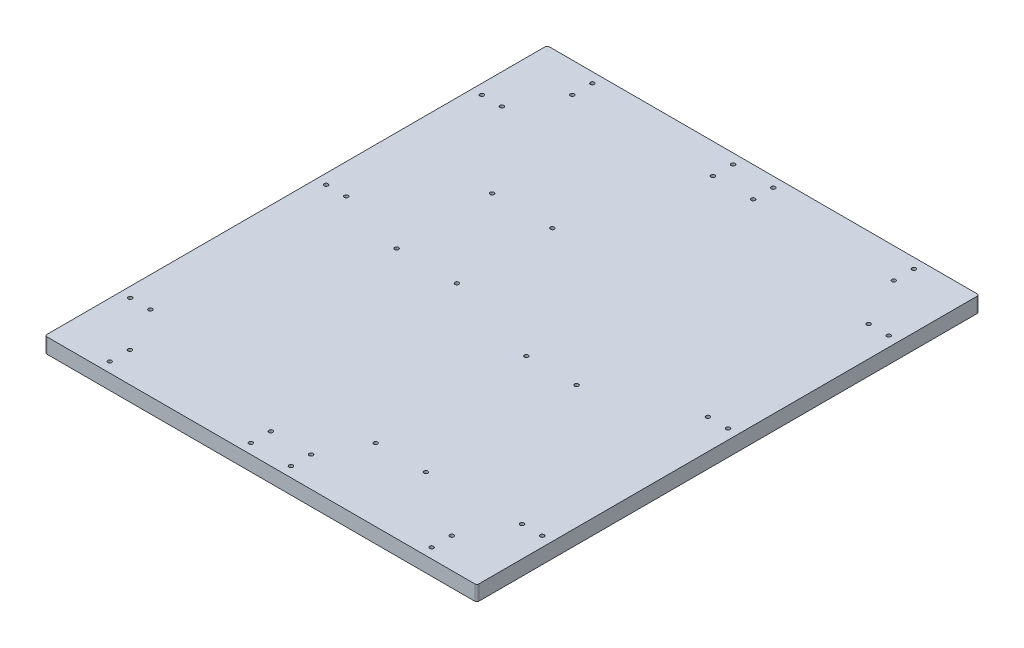
from build123d import *

# Parameters (mm, degrees)
SKETCH1_W           = 430
SKETCH1_H           = 500
BOSS_EXTRUDE1_DEPTH = 15
SKETCH12_R          = 1.95
CUT_EXTRUDE3_DEPTH  = 50.8
SKETCH6_R           = 1.95
CUT_EXTRUDE4_DEPTH  = 50.8
SKETCH7_R           = 1.95
CUT_EXTRUDE5_DEPTH  = 50.8
FILLET1_R           = 2


with BuildPart() as part:
    # Sketch1 → Boss-Extrude1 (new body)
    with BuildSketch(Plane(origin=(0, 0, 0), x_dir=(1, 0, 0), z_dir=(0, 1, 0))):
        Rectangle(SKETCH1_W, SKETCH1_H)
    extrude(amount=BOSS_EXTRUDE1_DEPTH)

    # Sketch12 → Cut-Extrude3 (cut)
    with BuildSketch(Plane(origin=(0, 0, 0), x_dir=(-1, 0, 0), z_dir=(0, -1, 0))):
        with Locations((-185, -175)):
            Circle(SKETCH12_R)
        with Locations((-205, 170)):
            Circle(SKETCH12_R)
        with Locations((-185, 10)):
            Circle(SKETCH12_R)
        with Locations((-205, 10)):
            Circle(SKETCH12_R)
        with Locations((-205, -175)):
            Circle(SKETCH12_R)
        with Locations((-185, 170)):
            Circle(SKETCH12_R)
        with Locations((205, -175)):
            Circle(SKETCH12_R)
        with Locations((205, 20)):
            Circle(SKETCH12_R)
        with Locations((185, 175)):
            Circle(SKETCH12_R)
        with Locations((205, 175)):
            Circle(SKETCH12_R)
        with Locations((185, -175)):
            Circle(SKETCH12_R)
        with Locations((185, 20)):
            Circle(SKETCH12_R)
        with Locations((160.349922153, -240)):
            Circle(SKETCH12_R)
        with Locations((160.349922153, -220)):
            Circle(SKETCH12_R)
        with Locations((20, -240)):
            Circle(SKETCH12_R)
        with Locations((20, -220)):
            Circle(SKETCH12_R)
        with Locations((-20, -220)):
            Circle(SKETCH12_R)
        with Locations((-20, -240)):
            Circle(SKETCH12_R)
        with Locations((-160, -240)):
            Circle(SKETCH12_R)
        with Locations((-160, -220)):
            Circle(SKETCH12_R)
        with Locations((160, 220)):
            Circle(SKETCH12_R)
        with Locations((160, 240)):
            Circle(SKETCH12_R)
        with Locations((20, 220)):
            Circle(SKETCH12_R)
        with Locations((20, 240)):
            Circle(SKETCH12_R)
        with Locations((-20, 220)):
            Circle(SKETCH12_R)
        with Locations((-20, 240)):
            Circle(SKETCH12_R)
        with Locations((-160, 220)):
            Circle(SKETCH12_R)
        with Locations((-160, 240)):
            Circle(SKETCH12_R)
    extrude(amount=-CUT_EXTRUDE3_DEPTH, mode=Mode.SUBTRACT)

    # Sketch6 → Cut-Extrude4 (cut)
    with BuildSketch(Plane(origin=(0, 15, 0), x_dir=(1, 0, 0), z_dir=(0, 1, 0))):
        with Locations((92.292697989, -28)):
            Circle(SKETCH6_R)
        with Locations((42.292697989, -28)):
            Circle(SKETCH6_R)
        with Locations((92.292697989, -178)):
            Circle(SKETCH6_R)
        with Locations((42.292697989, -178)):
            Circle(SKETCH6_R)
    extrude(amount=-CUT_EXTRUDE4_DEPTH, mode=Mode.SUBTRACT)

    # Sketch7 → Cut-Extrude5 (cut)
    with BuildSketch(Plane(origin=(0, 15, 0), x_dir=(1, 0, 0), z_dir=(0, 1, 0))):
        with Locations((-114.979961576, 95.192396061)):
            Circle(SKETCH7_R)
        with Locations((-54.979961576, 95.192396061)):
            Circle(SKETCH7_R)
        with Locations((-54.979961576, 0.192396061)):
            Circle(SKETCH7_R)
        with Locations((-114.979961576, 0.192396061)):
            Circle(SKETCH7_R)
    extrude(amount=-CUT_EXTRUDE5_DEPTH, mode=Mode.SUBTRACT)

    # Fillet1
    fillet1_edges = [part.edges().sort_by_distance(p)[0] for p in [
        (215, 7.5, -250),
        (215, 7.5, 250),
        (-215, 7.5, 250),
        (-215, 7.5, -250),
    ]]
    fillet(fillet1_edges, radius=FILLET1_R)


solid = part.part
